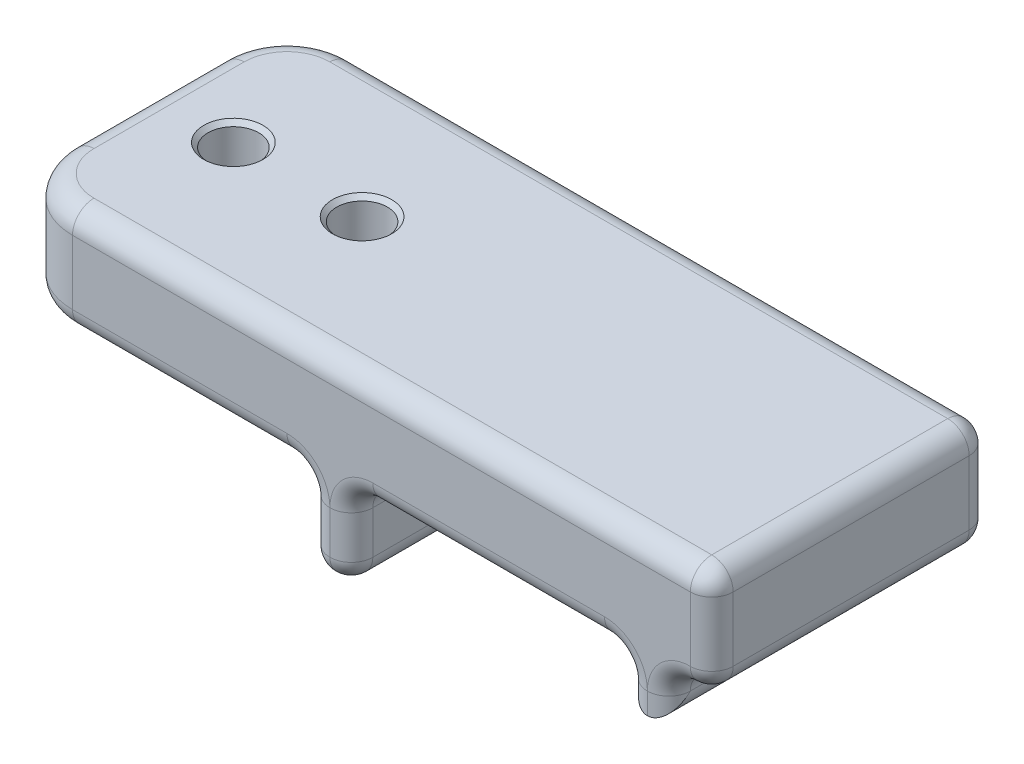
from build123d import *

# Parameters (mm, degrees)
SKETCH1_W             = 41.656
SKETCH1_H             = 16.51
BOSS_EXTRUDE1_DEPTH   = 6.35
SKETCH2_W             = 2.54
SKETCH2_H             = 16.51
BOSS_EXTRUDE2_DEPTH   = 2.54
SKETCH3_W             = 2.54
SKETCH3_H             = 16.51
BOSS_EXTRUDE3_DEPTH   = 5.08
F_3_0MM_DOWEL_HOLE1_D = 3
FILLET1_R             = 1.27
CHAMFER1_SIZE         = 0.254
FILLET2_R             = 3.81


# Some blends are built 0.0001 mm under size
with BuildPart() as part:
    # Sketch1 → Boss-Extrude1 (new body)
    with BuildSketch(Plane(origin=(0, 0, 0), x_dir=(1, 0, 0), z_dir=(0, 1, 0))):
        with Locations((20.828, 8.255)):
            Rectangle(SKETCH1_W, SKETCH1_H)
    extrude(amount=BOSS_EXTRUDE1_DEPTH)

    # Sketch2 → Boss-Extrude2 (add)
    with BuildSketch(Plane.XZ):
        with Locations((37.846, -8.255)):
            Rectangle(SKETCH2_W, SKETCH2_H)
    extrude(amount=BOSS_EXTRUDE2_DEPTH)

    # Sketch3 → Boss-Extrude3 (add)
    with BuildSketch(Plane.XZ):
        with Locations((19.05, -8.255)):
            Rectangle(SKETCH3_W, SKETCH3_H)
    extrude(amount=BOSS_EXTRUDE3_DEPTH)

    # Ø3.0mm Dowel Hole1 (through all)
    with Locations(Plane(origin=(0, 6.35, 0), x_dir=(1, 0, 0), z_dir=(0, 1, 0))):
        with Locations((5.08, 8.255), (12.7, 8.255)):
            Hole(F_3_0MM_DOWEL_HOLE1_D / 2)

    # Fillet1
    fillet1_edges = [part.edges().sort_by_distance(p)[0] for p in [
        (41.656, 6.35, -8.255),
        (20.828, 6.35, -16.51),
        (28.448, 0, -16.51),
        (40.386, 0, 0),
        (39.116, 0, -8.255),
        (39.116, -1.27, -16.51),
        (39.116, -1.27, 0),
        (36.576, 0, -8.255),
        (36.576, -1.27, 0),
        (36.576, -1.27, -16.51),
        (39.116, -2.54, -8.255),
        (36.576, -2.54, -8.255),
        (28.448, 0, 0),
        (8.89, 0, -16.51),
        (20.32, 0, -8.255),
        (20.32, -2.54, -16.51),
        (20.32, -2.54, 0),
        (17.78, 0, -8.255),
        (17.78, -2.54, 0),
        (17.78, -2.54, -16.51),
        (20.32, -5.08, -8.255),
        (19.05, -5.08, 0),
        (17.78, -5.08, -8.255),
        (19.05, -5.08, -16.51),
        (0, 6.35, -8.255),
        (40.386, 0, -16.51),
        (41.656, 0, -8.255),
        (8.89, 0, 0),
        (0, 0, -8.255),
        (20.828, 6.35, 0),
        (41.656, 3.175, -16.51),
        (41.656, 3.175, 0),
    ]]
    fillet(fillet1_edges, radius=FILLET1_R - 0.0001)  # a hair under: the kernel refuses the full size

    # Chamfer1
    chamfer1_edges = [part.edges().sort_by_distance(p)[0] for p in [
        (14.2, 0, -8.255),
        (14.2, 6.35, -8.255),
        (6.58, 0, -8.255),
        (6.58, 6.35, -8.255),
    ]]
    chamfer(chamfer1_edges, length=CHAMFER1_SIZE)

    # Fillet2
    # the kernel refuses this fillet: 3.81 mm, written as the material it takes off along each edge
    with BuildSketch(Plane(origin=(3.81, 0, -3.81), x_dir=(0, 0, 1), z_dir=(1, 0, 0))) as fillet2_piece_1:
        with BuildLine():
            CenterArc((2.5401, -1.2699), 1.2699, 0, 90)
            Line((3.81, -1.2699), (3.81, 0))
            Line((3.81, 0), (2.5401, 0))
        make_face()
    revolve(axis=Axis((3.81, 0, -3.81), (0, -1, 0)), revolution_arc=90, mode=Mode.SUBTRACT)
    with BuildSketch(Plane(origin=(3.81, 0, -12.7), x_dir=(-1, 0, 0), z_dir=(0, 0, 1))) as fillet2_piece_2:
        with BuildLine():
            CenterArc((2.5401, -1.2699), 1.2699, 0, 90)
            Line((3.81, -1.2699), (3.81, 0))
            Line((3.81, 0), (2.5401, 0))
        make_face()
    revolve(axis=Axis((3.81, 0, -12.7), (0, -1, 0)), revolution_arc=90, mode=Mode.SUBTRACT)
    with BuildSketch(Plane(origin=(3.81, 6.35, -3.81), x_dir=(-1, 0, 0), z_dir=(0, 0, -1))) as fillet2_piece_3:
        with BuildLine():
            CenterArc((2.5401, -1.2699), 1.2699, 0, 90)
            Line((3.81, -1.2699), (3.81, 0))
            Line((3.81, 0), (2.5401, 0))
        make_face()
    revolve(axis=Axis((3.81, 6.35, -3.81), (0, 1, 0)), revolution_arc=90, mode=Mode.SUBTRACT)
    with BuildSketch(Plane(origin=(3.81, 6.35, -12.7), x_dir=(0, 0, -1), z_dir=(1, 0, 0))) as fillet2_piece_4:
        with BuildLine():
            CenterArc((2.5401, -1.2699), 1.2699, 0, 90)
            Line((3.81, -1.2699), (3.81, 0))
            Line((3.81, 0), (2.5401, 0))
        make_face()
    revolve(axis=Axis((3.81, 6.35, -12.7), (0, 1, 0)), revolution_arc=90, mode=Mode.SUBTRACT)
    with BuildSketch(Plane(origin=(0, 0, -16.51), x_dir=(1, 0, 0), z_dir=(0, 1, 0)), Plane(origin=(0, 0, 0), x_dir=(0, 0, -1), z_dir=(0, 1, 0))) as fillet2_piece_5:
        with BuildLine():
            CenterArc((FILLET2_R, -FILLET2_R), FILLET2_R, 90, 90)
            Line((0, -FILLET2_R), (0, 0))
            Line((0, 0), (FILLET2_R, 0))
        make_face()
    extrude(amount=6.35, mode=Mode.SUBTRACT)


solid = part.part
